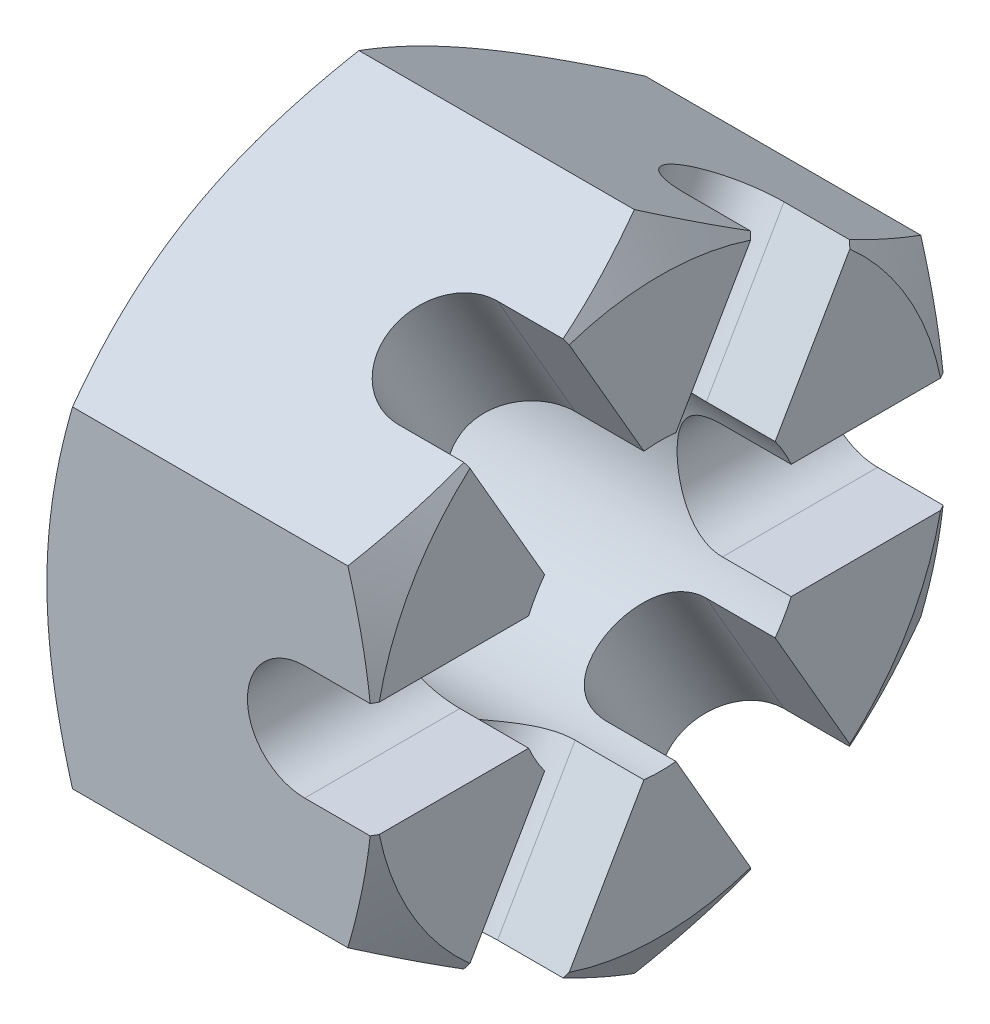
from build123d import *

# Parameters (mm, degrees)
SKETCH1_R          = 2.5
EXTRUDE1_DEPTH     = 2.85
CUT_EXTRUDE2_DEPTH = 9.152044733
CIRPATTERN1_COUNT  = 3


# Read off the part's stored shape, not the designer's step: Cut-Extrude1
with BuildPart() as part:
    # Sketch1 → Extrude1 (new, symmetric)
    with BuildSketch(Plane(origin=(0, 0, 0), x_dir=(0, 0, -1), z_dir=(1, 0, 0))):
        Polygon((5, 2.886751346), (0, 5.773502692), (-5, 2.886751346), (-5, -2.886751346), (0, -5.773502692), (5, -2.886751346), align=None)
        Circle(SKETCH1_R, mode=Mode.SUBTRACT)
    extrude(amount=EXTRUDE1_DEPTH, both=True)

    # Sketch3 → Cut-Extrude2 (cut, symmetric)
    with BuildSketch(Plane.XY):
        with BuildLine():
            Line((2.85, -1), (1.65, -1))
            ThreePointArc((1.65, -1), (0.65, 0), (1.65, 1))
            Line((1.65, 1), (2.85, 1))
            ThreePointArc((2.85, 1), (3.85, 0), (2.85, -1))
        make_face()
    cut_extrude2 = extrude(amount=CUT_EXTRUDE2_DEPTH, both=True, mode=Mode.SUBTRACT)

    # CirPattern1: Cut-Extrude2 ×3 about axis
    cirpattern1_axis = Axis((0, 0, 0), (1, 0, 0))
    for i in range(1, CIRPATTERN1_COUNT):
        add(cut_extrude2.rotate(cirpattern1_axis, i * 360 / CIRPATTERN1_COUNT), mode=Mode.SUBTRACT)

    # Cut-Extrude1 outline → Cut-Extrude1 (revolve, cut)
    with BuildSketch(Plane.YX):
        Polygon((5.773502692, -2.403418013), (4.999998537, -2.850000845), (5.773502692, -2.850000845), align=None)
    cut_extrude1 = revolve(axis=Axis((0, 0, 0), (1, 0, 0)), mode=Mode.SUBTRACT)

    # Mirror1: Cut-Extrude1 across plane
    add(cut_extrude1.mirror(Plane(origin=(0, 0, 0), x_dir=(0, 0, 1), z_dir=(1, 0, 0))), mode=Mode.SUBTRACT)


solid = part.part
